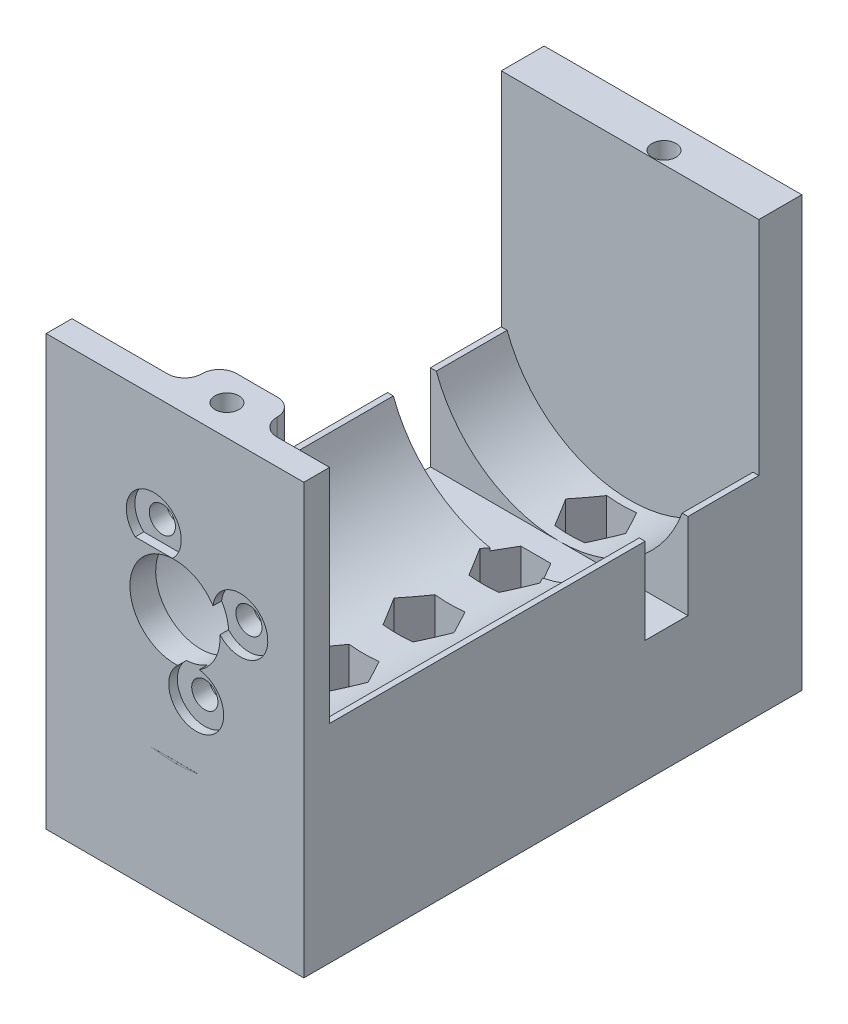
from build123d import *
from build123d.topology import SkipClean

# Parameters (mm, degrees)
SKETCH1_R           = 1.525
BOSS_EXTRUDE1_DEPTH = 3
BOSS_EXTRUDE2_DEPTH = 53
SKETCH3_R           = 1.55
CUT_EXTRUDE1_DEPTH  = 68.267232922
BOSS_EXTRUDE3_DEPTH = 3
CUT_EXTRUDE2_START  = -5
SKETCH5_R           = 1.55
CUT_EXTRUDE2_DEPTH  = 63.267232996
SKETCH6_R           = 3.2
CUT_EXTRUDE3_DEPTH  = 1
SKETCH7_W           = 30
SKETCH7_H           = 50
BOSS_EXTRUDE4_DEPTH = 5
SKETCH9_W           = 5
SKETCH9_H           = 20
CUT_EXTRUDE6_DEPTH  = 70.215826406
SKETCH10_R          = 7.5
CUT_EXTRUDE7_DEPTH  = 5
SKETCH12_R          = 1.4
CUT_EXTRUDE8_DEPTH  = 10
SKETCH13_W          = 30
SKETCH13_H          = 3
BOSS_EXTRUDE5_DEPTH = 7.575
BOSS_EXTRUDE6_START = -3
BOSS_EXTRUDE6_DEPTH = 3
SKETCH15_W          = 8.745849688
SKETCH15_H          = 7
SKETCH15_R          = 1.4
BOSS_EXTRUDE7_DEPTH = 5
SKETCH16_R          = 1.4
CUT_EXTRUDE9_DEPTH  = 7
FILLET1_R           = 2


with BuildPart() as part:
    # Sketch1 → Boss-Extrude1 (new body)
    with BuildSketch(Plane.XY):
        with BuildLine():
            Line((-15, -15), (15, -15))
            Line((15, -15), (15, 13))
            Line((15, 13), (-15, 13))
            Line((-15, 13), (-15, 5.25))
            Line((-15, 5.25), (0, 5.25))
            ThreePointArc((0, 5.25), (3.712310601, 3.712310601), (5.25, 0))
            ThreePointArc((5.25, 0), (3.712310601, -3.712310601), (0, -5.25))
            Line((0, -5.25), (-15, -5.25))
            Line((-15, -5.25), (-15, -15))
        make_face()
        with Locations((-2.472135955, 7.60845213)):
            Circle(SKETCH1_R, mode=Mode.SUBTRACT)
        with Locations((7.60845213, 2.472135955)):
            Circle(SKETCH1_R, mode=Mode.SUBTRACT)
        with Locations((2.472135955, -7.60845213)):
            Circle(SKETCH1_R, mode=Mode.SUBTRACT)
    extrude(amount=BOSS_EXTRUDE1_DEPTH)

    # Sketch2 → Boss-Extrude2 (add)
    with BuildSketch(Plane.XY.offset(3)):
        with BuildLine():
            Line((-15, -15), (-15, -5.25))
            Line((-15, -5.25), (-14.317821063, -5.25))
            ThreePointArc((-14.317821063, -5.25), (0, -15.25), (14.317821063, -5.25))
            Line((14.317821063, -5.25), (15, -5.25))
            Line((15, -5.25), (15, -15))
            Line((15, -15), (15, -29.425))
            Line((15, -29.425), (-15, -29.425))
            Line((-15, -29.425), (-15, -15))
        make_face()
    extrude(amount=-BOSS_EXTRUDE2_DEPTH)

    # Sketch3 → Cut-Extrude1 (cut, through all)
    with BuildSketch(Plane(origin=(0, -29.425, 0), x_dir=(-1, 0, 0), z_dir=(0, -1, 0))):
        with Locations(Location((0, 46, 0), (0, 0, 90))):
            Circle(SKETCH3_R)
        with Locations(Location((0, 36, 0), (0, 0, 90))):
            Circle(SKETCH3_R)
        with Locations(Location((0, 26, 0), (0, 0, 90))):
            Circle(SKETCH3_R)
        with Locations(Location((0, 16, 0), (0, 0, 90))):
            Circle(SKETCH3_R)
        with Locations(Location((0, 6, 0), (0, 0, 90))):
            Circle(SKETCH3_R)
    extrude(amount=-CUT_EXTRUDE1_DEPTH, mode=Mode.SUBTRACT)

    # Sketch5 → Cut-Extrude2 (cut, through all)
    # profile 1 of 5: a face of its own
    with BuildSketch(Plane(origin=(0, -29.425, 0), x_dir=(-1, 0, 0), z_dir=(0, -1, 0)).offset(CUT_EXTRUDE2_START)):
        Polygon((1.746484564, 32.975), (3.492969129, 36), (1.746484564, 39.025), (-1.746484564, 39.025), (-3.492969129, 36), (-1.746484564, 32.975), align=None)
        with Locations(Location((0, 36, 0), (0, 0, 90))):
            Circle(SKETCH5_R, mode=Mode.SUBTRACT)
    # profile 2 of 5: a face of its own
    with BuildSketch(Plane(origin=(0, -29.425, 0), x_dir=(-1, 0, 0), z_dir=(0, -1, 0)).offset(CUT_EXTRUDE2_START)):
        Polygon((1.746484564, 42.975), (3.492969129, 46), (1.746484564, 49.025), (-1.746484564, 49.025), (-3.492969129, 46), (-1.746484564, 42.975), align=None)
        with Locations(Location((0, 46, 0), (0, 0, 90))):
            Circle(SKETCH5_R, mode=Mode.SUBTRACT)
    # profile 3 of 5: a face of its own
    with BuildSketch(Plane(origin=(0, -29.425, 0), x_dir=(-1, 0, 0), z_dir=(0, -1, 0)).offset(CUT_EXTRUDE2_START)):
        Polygon((1.746484564, 22.975), (3.492969129, 26), (1.746484564, 29.025), (-1.746484564, 29.025), (-3.492969129, 26), (-1.746484564, 22.975), align=None)
        with Locations(Location((0, 26, 0), (0, 0, 90))):
            Circle(SKETCH5_R, mode=Mode.SUBTRACT)
    # profile 4 of 5: a face of its own
    with BuildSketch(Plane(origin=(0, -29.425, 0), x_dir=(-1, 0, 0), z_dir=(0, -1, 0)).offset(CUT_EXTRUDE2_START)):
        Polygon((1.746484564, 12.975), (3.492969129, 16), (1.746484564, 19.025), (-1.746484564, 19.025), (-3.492969129, 16), (-1.746484564, 12.975), align=None)
        with Locations(Location((0, 16, 0), (0, 0, 90))):
            Circle(SKETCH5_R, mode=Mode.SUBTRACT)
    # profile 5 of 5: a face of its own
    with BuildSketch(Plane(origin=(0, -29.425, 0), x_dir=(-1, 0, 0), z_dir=(0, -1, 0)).offset(CUT_EXTRUDE2_START)):
        Polygon((1.746484564, 2.975), (3.492969129, 6), (1.746484564, 9.025), (-1.746484564, 9.025), (-3.492969129, 6), (-1.746484564, 2.975), align=None)
        with Locations(Location((0, 6, 0), (0, 0, 90))):
            Circle(SKETCH5_R, mode=Mode.SUBTRACT)
    extrude(amount=-CUT_EXTRUDE2_DEPTH, mode=Mode.SUBTRACT)

    # Sketch6 → Cut-Extrude3 (cut)
    with BuildSketch(Plane.XY.offset(3)):
        with Locations((2.472135955, -7.60845213)):
            Circle(SKETCH6_R)
        with Locations((-2.472135955, 7.60845213)):
            Circle(SKETCH6_R)
        with Locations((7.60845213, 2.472135955)):
            Circle(SKETCH6_R)
    extrude(amount=-CUT_EXTRUDE3_DEPTH, mode=Mode.SUBTRACT)

    # Sketch7 → Boss-Extrude4 (add)
    with BuildSketch(Plane(origin=(0, 0, -50), x_dir=(-1, 0, 0), z_dir=(0, 0, -1))):
        with Locations((0, -4.425)):
            Rectangle(SKETCH7_W, SKETCH7_H)
    extrude(amount=BOSS_EXTRUDE4_DEPTH)

    # Sketch9 → Cut-Extrude6 (cut, through all)
    with BuildSketch(Plane.ZY.offset(15)):
        with Locations((-39.25, -5.25)):
            Rectangle(SKETCH9_W, SKETCH9_H)
    extrude(amount=-CUT_EXTRUDE6_DEPTH, mode=Mode.SUBTRACT)

    # Sketch10 → Cut-Extrude7 (cut)
    with BuildSketch(Plane(origin=(0, -29.425, 0), x_dir=(-1, 0, 0), z_dir=(0, -1, 0))):
        with Locations(Location((5, 26, 0), (0, 0, 90))):
            Circle(SKETCH10_R)
    extrude(amount=-CUT_EXTRUDE7_DEPTH, mode=Mode.SUBTRACT)

    # Sketch12 → Cut-Extrude8 (cut)
    with BuildSketch(Plane(origin=(0, 20.575, 0), x_dir=(1, 0, 0), z_dir=(0, 1, 0))):
        with Locations(Location((2.5, 51.45, 0), (0, 0, 270))):
            Circle(SKETCH12_R)
    extrude(amount=-CUT_EXTRUDE8_DEPTH, mode=Mode.SUBTRACT)

    # Sketch13 → Boss-Extrude5 (add)
    with BuildSketch(Plane(origin=(0, 13, 0), x_dir=(1, 0, 0), z_dir=(0, 1, 0))):
        with Locations((0, -1.5)):
            Rectangle(SKETCH13_W, SKETCH13_H)
    extrude(amount=BOSS_EXTRUDE5_DEPTH)

    # Sketch14 → Boss-Extrude6 (add)
    with BuildSketch(Plane.XY.offset(3).offset(BOSS_EXTRUDE6_START)):
        with BuildLine():
            Line((0, 5.25), (-15, 5.25))
            Line((-15, 5.25), (-15, -5.25))
            Line((-15, -5.25), (0, -5.25))
            ThreePointArc((0, -5.25), (-5.25, 0), (0, 5.25))
        make_face()
    extrude(amount=BOSS_EXTRUDE6_DEPTH)

    # Sketch15 → Boss-Extrude7 (add)
    with BuildSketch(Plane(origin=(0, 20.575, 0), x_dir=(1, 0, 0), z_dir=(0, 1, 0))):
        with Locations((2.5, 0.55)):
            Rectangle(SKETCH15_W, SKETCH15_H)
        with Locations((2.5, 0.55)):
            Circle(SKETCH15_R, mode=Mode.SUBTRACT)
    extrude(amount=-BOSS_EXTRUDE7_DEPTH)

    # Sketch16 → Cut-Extrude9 (cut)
    with SkipClean():  # the faces are left unmerged after this step: merging them gives an invalid solid
        with BuildSketch(Plane(origin=(0, 20.575, 0), x_dir=(1, 0, 0), z_dir=(0, 1, 0))):
            with Locations(Location((2.5, 0.55, 0), (0, 0, 203.132396399))):
                Circle(SKETCH16_R)
        extrude(amount=-CUT_EXTRUDE9_DEPTH, mode=Mode.SUBTRACT)
    add(part.part.scale(1), mode=Mode.REPLACE)  # the faces are merged on a copy

    # Fillet1
    # the kernel refuses this fillet: 2 mm, written as the material it adds along each edge
    with BuildSketch(Plane(origin=(6.212560681, 15.575, 0), x_dir=(0, -1, 0), z_dir=(-1, 0, 0))) as fillet1_piece_1_section:
        with BuildLine():
            CenterArc((FILLET1_R, -FILLET1_R), FILLET1_R, 90, 90)
            Line((0, -FILLET1_R), (0, 0))
            Line((0, 0), (FILLET1_R, 0))
        make_face()
    fillet1_piece_1 = extrude(amount=8.085485525, mode=Mode.PRIVATE)
    fillet1_piece_1 = fillet1_piece_1 - Plane(origin=(2.5, 15.575, -0.55), x_dir=(1, 0, 0), z_dir=(0, 1, 0)) * Cylinder(1.4, 25, mode=Mode.PRIVATE)
    add(fillet1_piece_1)
    with BuildSketch(Plane(origin=(6.872924844, 15.575, 0), x_dir=(0, -1, 0), z_dir=(-1, 0, 0))) as fillet1_piece_2_section:
        with BuildLine():
            CenterArc((FILLET1_R, -FILLET1_R), FILLET1_R, 90, 90)
            Line((0, -FILLET1_R), (0, 0))
            Line((0, 0), (FILLET1_R, 0))
        make_face()
    fillet1_piece_2 = extrude(amount=8.085485525, mode=Mode.PRIVATE)
    fillet1_piece_2 = fillet1_piece_2 - Plane(origin=(2.5, 15.575, -0.55), x_dir=(1, 0, 0), z_dir=(0, 1, 0)) * Cylinder(1.4, 25, mode=Mode.PRIVATE)
    add(fillet1_piece_2)
    with BuildSketch(Plane(origin=(6.872924844, 15.575, 0), x_dir=(1, 0, 0), z_dir=(0, 1, 0)), Plane(origin=(-1.872924844, 20.575, 0), x_dir=(-1, 0, 0), z_dir=(0, -1, 0))) as fillet1_piece_3:
        with BuildLine():
            CenterArc((FILLET1_R, FILLET1_R), FILLET1_R, 180, 90)
            Line((0, FILLET1_R), (0, 0))
            Line((0, 0), (FILLET1_R, 0))
        make_face()
    extrude(amount=5)
    with BuildSketch(Plane(origin=(-1.872924844, 20.575, 0), x_dir=(-1, 0, 0), z_dir=(0, -1, 0))) as fillet1_piece_4a_section:
        with BuildLine():
            CenterArc((FILLET1_R, FILLET1_R), FILLET1_R, 180, 90)
            Line((0, FILLET1_R), (0, 0))
            Line((0, 0), (FILLET1_R, 0))
        make_face()
    fillet1_piece_4a = extrude(amount=10, mode=Mode.PRIVATE)
    fillet1_piece_4a = split(fillet1_piece_4a, bisect_by=Plane(origin=(-1.872924844, 15.575, 0), z_dir=(0, -1, 0)), keep=Keep.TOP, mode=Mode.PRIVATE)
    with BuildSketch(Plane(origin=(6.212560681, 15.575, 0), x_dir=(0, -1, 0), z_dir=(-1, 0, 0))) as fillet1_piece_4b_section:
        with BuildLine():
            CenterArc((FILLET1_R, -FILLET1_R), FILLET1_R, 90, 90)
            Line((0, -FILLET1_R), (0, 0))
            Line((0, 0), (FILLET1_R, 0))
        make_face()
    fillet1_piece_4b = extrude(amount=13.085485525, mode=Mode.PRIVATE)
    fillet1_piece_4b = split(fillet1_piece_4b, bisect_by=Plane(origin=(-1.872924844, 15.575, 0), z_dir=(-1, 0, 0)), keep=Keep.TOP, mode=Mode.PRIVATE)
    fillet1_piece_4 = fillet1_piece_4a & fillet1_piece_4b
    add(fillet1_piece_4)
    with BuildSketch(Plane(origin=(11.872924844, 15.575, 0), x_dir=(0, -1, 0), z_dir=(-1, 0, 0))) as fillet1_piece_5a_section:
        with BuildLine():
            CenterArc((FILLET1_R, -FILLET1_R), FILLET1_R, 90, 90)
            Line((0, -FILLET1_R), (0, 0))
            Line((0, 0), (FILLET1_R, 0))
        make_face()
    fillet1_piece_5a = extrude(amount=13.085485525, mode=Mode.PRIVATE)
    fillet1_piece_5a = split(fillet1_piece_5a, bisect_by=Plane(origin=(6.872924844, 15.575, 0), z_dir=(1, 0, 0)), keep=Keep.TOP, mode=Mode.PRIVATE)
    with BuildSketch(Plane(origin=(6.872924844, 10.575, 0), x_dir=(1, 0, 0), z_dir=(0, 1, 0))) as fillet1_piece_5b_section:
        with BuildLine():
            CenterArc((FILLET1_R, FILLET1_R), FILLET1_R, 180, 90)
            Line((0, FILLET1_R), (0, 0))
            Line((0, 0), (FILLET1_R, 0))
        make_face()
    fillet1_piece_5b = extrude(amount=10, mode=Mode.PRIVATE)
    fillet1_piece_5b = split(fillet1_piece_5b, bisect_by=Plane(origin=(6.872924844, 15.575, 0), z_dir=(0, -1, 0)), keep=Keep.TOP, mode=Mode.PRIVATE)
    fillet1_piece_5 = fillet1_piece_5a & fillet1_piece_5b
    add(fillet1_piece_5)
    # the kernel refuses this fillet: 2 mm, written as the material it takes off along each edge
    with BuildSketch(Plane(origin=(6.872924844, 25.575, -4.05), x_dir=(-1, 0, 0), z_dir=(0, -1, 0)), Plane(origin=(-1.872924844, 25.575, -4.05), x_dir=(0, 0, 1), z_dir=(0, -1, 0))) as fillet1_2_piece_1:
        with BuildLine():
            CenterArc((FILLET1_R, -FILLET1_R), FILLET1_R, 90, 90)
            Line((0, -FILLET1_R), (0, 0))
            Line((0, 0), (FILLET1_R, 0))
        make_face()
    extrude(amount=15, mode=Mode.SUBTRACT)


with BuildPart() as body_2:
    # Sketch4 → Boss-Extrude3 (new body)
    with BuildSketch(Plane.XY.offset(3)):
        with BuildLine():
            Line((-2.75, -15), (2.693973064, -15.010163528))
            ThreePointArc((2.693973064, -15.010163528), (-0.028470664, -15.249973424), (-2.75, -15))
        make_face()
    extrude(amount=-BOSS_EXTRUDE3_DEPTH)


solid = Compound([part.part, body_2.part])
